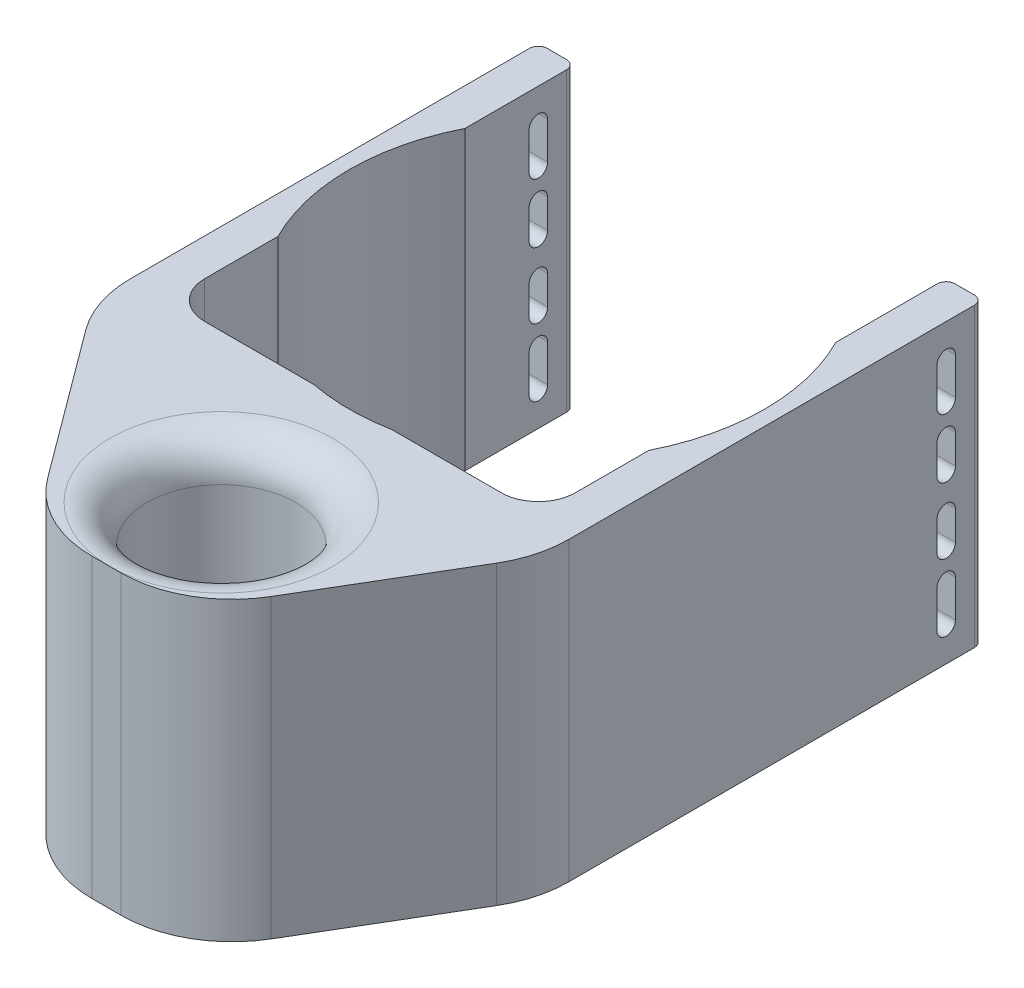
from build123d import *

# Parameters (mm, degrees)
SKETCH1_R           = 12.7
BOSS_EXTRUDE1_DEPTH = 25.4
SKETCH2_R           = 35.56
CUT_EXTRUDE1_DEPTH  = 50.8
CUT_EXTRUDE2_DEPTH  = 127
FILLET1_R           = 6.35


with BuildPart() as part:
    # Sketch1 → Boss-Extrude1 (new, symmetric)
    with BuildSketch(Plane(origin=(0, 0, 0), x_dir=(1, 0, 0), z_dir=(0, 1, 0))):
        with BuildLine():
            Line((6.35, 0), (57.15, 0))
            ThreePointArc((57.15, 0), (61.640128061, 1.859871939), (63.5, 6.35))
            Line((63.5, 6.35), (63.5, 68.326))
            ThreePointArc((63.5, 68.326), (63.946369265, 69.403630735), (65.024, 69.85))
            Line((65.024, 69.85), (68.326, 69.85))
            ThreePointArc((68.326, 69.85), (69.403630735, 69.403630735), (69.85, 68.326))
            Line((69.85, 68.326), (69.85, -1.133947157))
            ThreePointArc((69.85, -1.133947157), (69.173698323, -6.16482282), (67.192812606, -10.83849222))
            Line((67.192812606, -10.83849222), (52.827309323, -35.104545063))
            ThreePointArc((52.827309323, -35.104545063), (45.869297101, -41.949532976), (36.434496717, -44.45))
            Line((36.434496717, -44.45), (31.486207829, -44.45))
            ThreePointArc((31.486207829, -44.45), (22.919370647, -42.415046303), (16.182781968, -36.744939705))
            Line((16.182781968, -36.744939705), (-2.603425861, -11.403832022))
            ThreePointArc((-2.603425861, -11.403832022), (-5.389123288, -6.032678275), (-6.35, -0.058892317))
            Line((-6.35, -0.058892317), (-6.35, 68.326))
            ThreePointArc((-6.35, 68.326), (-5.903630735, 69.403630735), (-4.826, 69.85))
            Line((-4.826, 69.85), (-1.524, 69.85))
            ThreePointArc((-1.524, 69.85), (-0.446369265, 69.403630735), (0, 68.326))
            Line((0, 68.326), (0, 6.35))
            ThreePointArc((0, 6.35), (1.859871939, 1.859871939), (6.35, 0))
        make_face()
        with Locations(Location((34.5948, -25.4, 0), (0, 0, 270))):
            Circle(SKETCH1_R, mode=Mode.SUBTRACT)
    extrude(amount=BOSS_EXTRUDE1_DEPTH, both=True)

    # Sketch2 → Cut-Extrude1 (cut)
    with BuildSketch(Plane(origin=(0, 25.4, 0), x_dir=(1, 0, 0), z_dir=(0, 1, 0))):
        with Locations((31.75, 34.925)):
            Circle(SKETCH2_R)
    extrude(amount=-CUT_EXTRUDE1_DEPTH, mode=Mode.SUBTRACT)

    # Sketch3 → Cut-Extrude2 (cut)
    with BuildSketch(Plane(origin=(69.85, 0, 0), x_dir=(0, 0, -1), z_dir=(1, 0, 0))):
        with BuildLine():
            Line((65.0875, -3.175), (65.0875, -8.149687283))
            ThreePointArc((65.0875, -8.149687283), (63.5, -9.737187283), (61.9125, -8.149687283))
            Line((61.9125, -8.149687283), (61.9125, -3.175))
            ThreePointArc((61.9125, -3.175), (63.5, -1.5875), (65.0875, -3.175))
        make_face()
        with BuildLine():
            Line((65.0875, -13.335), (65.0875, -19.685))
            ThreePointArc((65.0875, -19.685), (63.5, -21.2725), (61.9125, -19.685))
            Line((61.9125, -19.685), (61.9125, -13.335))
            ThreePointArc((61.9125, -13.335), (63.5, -11.7475), (65.0875, -13.335))
        make_face()
        with BuildLine():
            Line((65.0875, 13.335), (65.0875, 19.685))
            ThreePointArc((65.0875, 19.685), (63.5, 21.2725), (61.9125, 19.685))
            Line((61.9125, 19.685), (61.9125, 13.335))
            ThreePointArc((61.9125, 13.335), (63.5, 11.7475), (65.0875, 13.335))
        make_face()
        with BuildLine():
            Line((65.0875, 3.175), (65.0875, 8.149687283))
            ThreePointArc((65.0875, 8.149687283), (63.5, 9.737187283), (61.9125, 8.149687283))
            Line((61.9125, 8.149687283), (61.9125, 3.175))
            ThreePointArc((61.9125, 3.175), (63.5, 1.5875), (65.0875, 3.175))
        make_face()
    extrude(amount=-CUT_EXTRUDE2_DEPTH, mode=Mode.SUBTRACT)

    # Fillet1
    fillet1_edges = [part.edges().sort_by_distance(p)[0] for p in [
        (34.5948, -25.4, 12.7),
        (34.5948, 25.4, 12.7),
    ]]
    fillet(fillet1_edges, radius=FILLET1_R - 0.0001)  # a hair under: the kernel refuses the full size


solid = part.part
